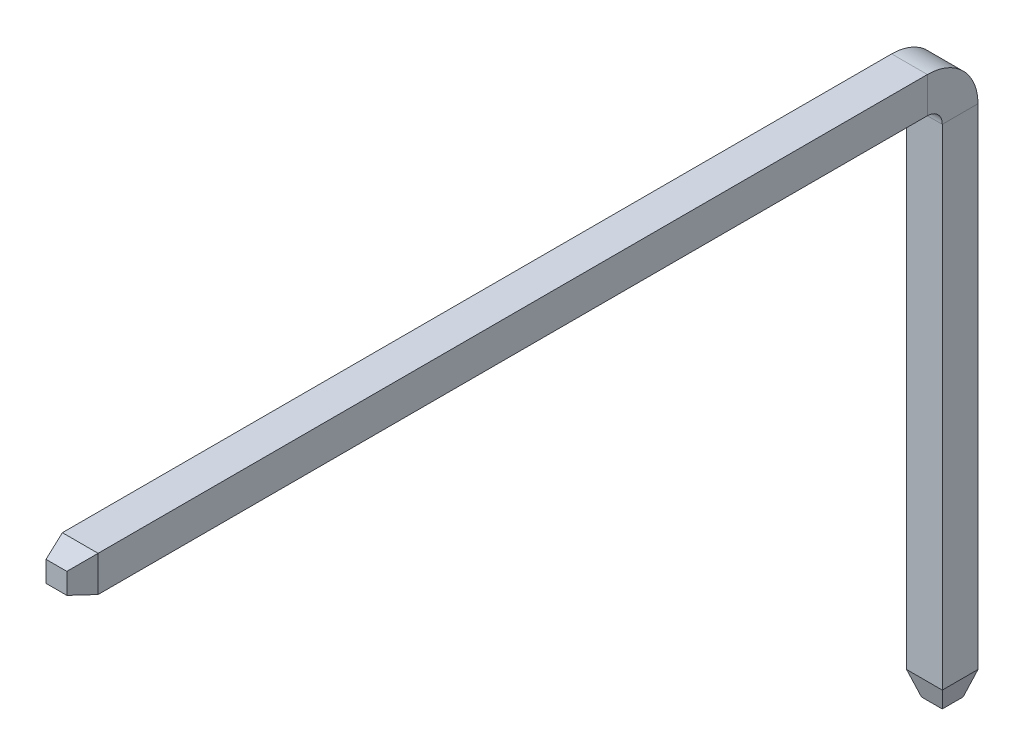
from build123d import *
from OCP.BRepFilletAPI import BRepFilletAPI_MakeChamfer

# Parameters (mm, degrees)
T_LE_DE_BASE_PLI_E1_DEPTH = 0.3
CHANFREIN1_SIZE           = 0.4
CHANFREIN1_SIZE2          = 0.125


# Sheet-metal steps are written as plain solids
with BuildPart() as part:
    # Esquisse2 → Tôle de base pliée1 (new, symmetric)
    with BuildSketch(Plane(origin=(0, 0, 0), x_dir=(0, 0, -1), z_dir=(1, 0, 0))):
        with BuildLine():
            Line((-6, 0), (0, 0))
            Line((0, 0), (8.33, 0))
            ThreePointArc((8.33, 0), (8.931040764, -0.248959236), (9.18, -0.85))
            Line((9.18, -0.85), (9.18, -9.48))
            Line((9.18, -9.48), (8.58, -9.48))
            Line((8.58, -9.48), (8.58, -0.85))
            ThreePointArc((8.58, -0.85), (8.506776695, -0.673223305), (8.33, -0.6))
            Line((8.33, -0.6), (0, -0.6))
            Line((0, -0.6), (-6, -0.6))
            Line((-6, -0.6), (-6, 0))
        make_face()
    extrude(amount=T_LE_DE_BASE_PLI_E1_DEPTH, both=True)

    # Chanfrein1: one chamfer whose edges measure the first distance from different faces: ONE call of the kernel's chamfer builder (chamfer() names one face for all edges)
    chanfrein1_edges_1 = [part.edges().sort_by_distance(p)[0] for p in [
        (-0.3, -9.48, -8.88),
        (-0.3, -0.3, 6),
    ]]
    chanfrein1_side_1 = [part.faces().sort_by_distance(p)[0] for p in [
        (-0.3, -0.178970053, -1.165),
    ]]
    chanfrein1_edges_2 = [part.edges().sort_by_distance(p)[0] for p in [
        (0, -0.6, 6),
    ]]
    chanfrein1_side_2 = [part.faces().sort_by_distance(p)[0] for p in [
        (0, -0.6, -1.165),
    ]]
    chanfrein1_edges_3 = [part.edges().sort_by_distance(p)[0] for p in [
        (0, 0, 6),
    ]]
    chanfrein1_side_3 = [part.faces().sort_by_distance(p)[0] for p in [
        (0, 0, -1.165),
    ]]
    chanfrein1_edges_4 = [part.edges().sort_by_distance(p)[0] for p in [
        (0, -9.48, -9.18),
    ]]
    chanfrein1_side_4 = [part.faces().sort_by_distance(p)[0] for p in [
        (0, -5.165, -9.18),
    ]]
    chanfrein1_edges_5 = [part.edges().sort_by_distance(p)[0] for p in [
        (0, -9.48, -8.58),
    ]]
    chanfrein1_side_5 = [part.faces().sort_by_distance(p)[0] for p in [
        (0, -5.165, -8.58),
    ]]
    chanfrein1_edges_6 = [part.edges().sort_by_distance(p)[0] for p in [
        (0.3, -0.3, 6),
        (0.3, -9.48, -8.88),
    ]]
    chanfrein1_side_6 = [part.faces().sort_by_distance(p)[0] for p in [
        (0.3, -0.178970053, -1.165),
    ]]
    chanfrein1 = BRepFilletAPI_MakeChamfer(part.part.solid().wrapped)
    for e in chanfrein1_edges_1:
        chanfrein1.Add(CHANFREIN1_SIZE, CHANFREIN1_SIZE2, e.wrapped, chanfrein1_side_1[0].wrapped)  # the first distance lies on this face
    for e in chanfrein1_edges_2:
        chanfrein1.Add(CHANFREIN1_SIZE, CHANFREIN1_SIZE2, e.wrapped, chanfrein1_side_2[0].wrapped)  # the first distance lies on this face
    for e in chanfrein1_edges_3:
        chanfrein1.Add(CHANFREIN1_SIZE, CHANFREIN1_SIZE2, e.wrapped, chanfrein1_side_3[0].wrapped)  # the first distance lies on this face
    for e in chanfrein1_edges_4:
        chanfrein1.Add(CHANFREIN1_SIZE, CHANFREIN1_SIZE2, e.wrapped, chanfrein1_side_4[0].wrapped)  # the first distance lies on this face
    for e in chanfrein1_edges_5:
        chanfrein1.Add(CHANFREIN1_SIZE, CHANFREIN1_SIZE2, e.wrapped, chanfrein1_side_5[0].wrapped)  # the first distance lies on this face
    for e in chanfrein1_edges_6:
        chanfrein1.Add(CHANFREIN1_SIZE, CHANFREIN1_SIZE2, e.wrapped, chanfrein1_side_6[0].wrapped)  # the first distance lies on this face
    add(Compound.cast(chanfrein1.Shape()), mode=Mode.REPLACE)


solid = part.part
